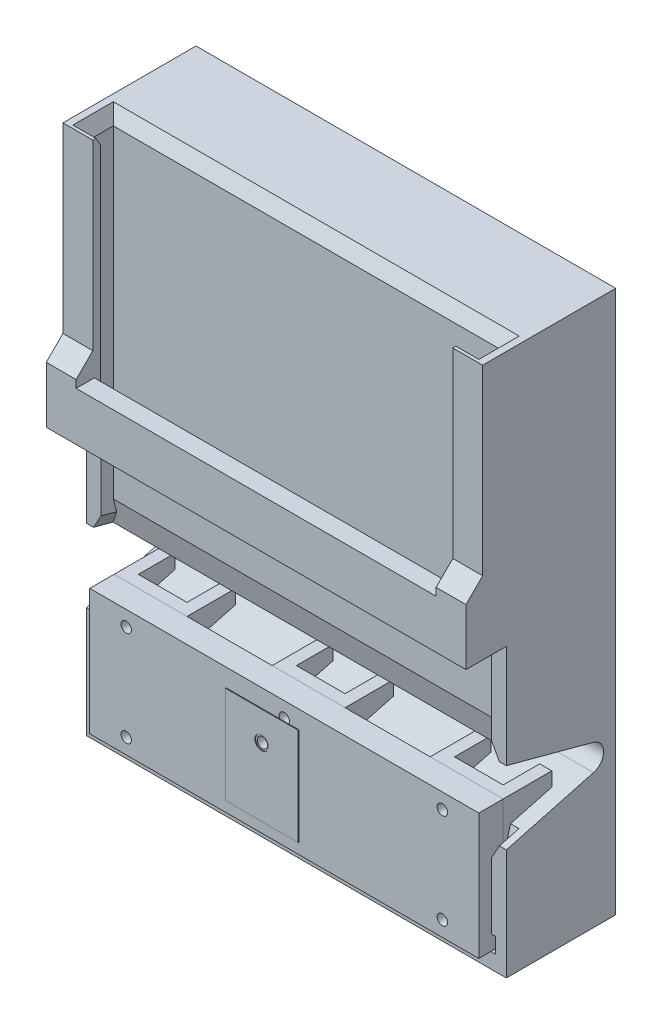
from build123d import *
from OCP.BRepFilletAPI import BRepFilletAPI_MakeChamfer

# Parameters (mm, degrees)
SKETCH1_W                          = 101.6
SKETCH1_H                          = 35.999999882
BOSS_EXTRUDE1_DEPTH                = 6.35
TAP_DRILL_FOR_6_32_TAP2_D          = 2.7051
SKETCH5_W                          = 16.399999966
SKETCH5_H                          = 3.000000096
CUT_EXTRUDE1_DEPTH                 = 61.104763545
MOVE_FACE1_BY                      = 0.100000054
MOVE_FACE1_2_BY                    = 0.100000054
MOVE_FACE1_3_BY                    = 0.100000054
MOVE_FACE1_4_BY                    = 0.100000054
SKETCH4_W                          = 19.05
SKETCH4_H                          = 25.4
SKETCH4_R                          = 1.78
BOSS_EXTRUDE2_DEPTH                = 0.178
BOSS_EXTRUDE3_DEPTH                = 32.899999732
LPATTERN1_COUNT                    = 3
LPATTERN1_PITCH                    = 41.275
SKETCH7_W                          = 101.6
SKETCH7_H                          = 3.10000015
CUT_EXTRUDE2_DEPTH                 = 63.730874382
SKETCH9_W                          = 1.35255
SKETCH9_H                          = 9.703
TAP_DRILL_FOR_6_32_TAP3_AT_2_COUNT = 2
TAP_DRILL_FOR_6_32_TAP3_AT_2_PITCH = 24.899999476
TAP_DRILL_FOR_6_32_TAP3_AT_3_COUNT = 2
TAP_DRILL_FOR_6_32_TAP3_AT_3_PITCH = 41.275
TAP_DRILL_FOR_6_32_TAP3_AT_4_COUNT = 2
TAP_DRILL_FOR_6_32_TAP3_AT_4_PITCH = 48.204103548
TAP_DRILL_FOR_6_32_TAP3_AT_5_COUNT = 2
TAP_DRILL_FOR_6_32_TAP3_AT_5_PITCH = 82.55
TAP_DRILL_FOR_6_32_TAP3_AT_6_COUNT = 2
TAP_DRILL_FOR_6_32_TAP3_AT_6_PITCH = 86.223619003
SKETCH15_W                         = 109.600000256
SKETCH15_H                         = 36.89999986
BOSS_EXTRUDE6_DEPTH                = 1.600000102
BOSS_EXTRUDE7_DEPTH                = 3.175
MOVE_FACE3_BY                      = 0.200000108
MOVE_FACE3_2_BY                    = 0.200000108
BOSS_EXTRUDE8_DEPTH                = 101.6
SKETCH18_W                         = 109.600000256
SKETCH18_H                         = 141.67499986
BOSS_EXTRUDE9_DEPTH                = 23.799999898
CUT_EXTRUDE5_DEPTH                 = 177.707301163
FILLET1_R                          = 3.543588
BOSS_EXTRUDE10_DEPTH               = 66.675
SKETCH21_W                         = 109.600000256
SKETCH21_H                         = 12.7
BOSS_EXTRUDE11_DEPTH               = 6.35
CHAMFER2_SIZE                      = 1.6
CHAMFER4_SIZE                      = 2
CHAMFER4_SIZE2                     = 3.464101615
CHAMFER4_SIZE2_2                   = 6.69213043
CHAMFER5_SIZE                      = 2
CHAMFER5_SIZE2                     = 3.464101615
CHAMFER6_SIZE                      = 1.2
CHAMFER6_SIZE2                     = 2.078460969
CHAMFER7_SIZE                      = 6.35
CUT_EXTRUDE6_DEPTH                 = 4.000000128


# Some blends are built 0.0001 mm under size
with BuildPart() as part:
    # Sketch1 → Boss-Extrude1 (new body)
    with BuildSketch(Plane.XY):
        with Locations((0, 13.490000071)):
            Rectangle(SKETCH1_W, SKETCH1_H)
    extrude(amount=BOSS_EXTRUDE1_DEPTH)

    # Tap Drill for #6-32 Tap2 (through all)
    with Locations(Plane.XY.offset(6.35)):
        with Locations((-5.70000003, 19.184999984)):
            Hole(TAP_DRILL_FOR_6_32_TAP2_D / 2)

    # Sketch5 → Cut-Extrude1 (cut, through all)
    with BuildSketch(Plane.XY.offset(6.35)):
        with Locations((42.600000017, -3.009999822)):
            Rectangle(SKETCH5_W, SKETCH5_H)
        with Locations((-42.600000017, -3.009999822)):
            Rectangle(SKETCH5_W, SKETCH5_H)
    extrude(amount=-CUT_EXTRUDE1_DEPTH, mode=Mode.SUBTRACT)

    # Move Face1: a face moved inward by 0.1
    extrude(part.faces().sort_by_distance((-42.600000017, -1.509999774, 3.175))[0], amount=MOVE_FACE1_BY, dir=(0, 1, 0), mode=Mode.SUBTRACT)

    # Move Face1 2: a face moved inward by 0.1
    extrude(part.faces().sort_by_distance((-34.400000034, -3.009999822, 3.175))[0], amount=MOVE_FACE1_2_BY, dir=(1, 0, 0), mode=Mode.SUBTRACT)

    # Move Face1 3: a face moved inward by 0.1
    extrude(part.faces().sort_by_distance((34.400000034, -3.009999822, 3.175))[0], amount=MOVE_FACE1_3_BY, dir=(-1, 0, 0), mode=Mode.SUBTRACT)

    # Move Face1 4: a face moved inward by 0.1
    extrude(part.faces().sort_by_distance((42.600000017, -1.509999774, 3.175))[0], amount=MOVE_FACE1_4_BY, dir=(0, 1, 0), mode=Mode.SUBTRACT)

    # Sketch7 → Cut-Extrude2 (cut, through all)
    with BuildSketch(Plane.XY.offset(6.35)):
        with Locations((0, -2.959999795)):
            Rectangle(SKETCH7_W, SKETCH7_H)
    extrude(amount=-CUT_EXTRUDE2_DEPTH, mode=Mode.SUBTRACT)


with BuildPart() as body_2:
    # Sketch4 → Boss-Extrude2 (new body)
    with BuildSketch(Plane.XY.offset(6.35)):
        with Locations((-5.70000003, 14.104999984)):
            Rectangle(SKETCH4_W, SKETCH4_H)
        with Locations(Location((-5.70000003, 19.184999984, 0), (0, 0, 180))):
            Circle(SKETCH4_R, mode=Mode.SUBTRACT)
    extrude(amount=BOSS_EXTRUDE2_DEPTH)


with BuildPart() as body_3:
    # Sketch6 → Boss-Extrude3 (new body)
    with BuildSketch(Plane(origin=(0, 31.490000012, 0), x_dir=(1, 0, 0), z_dir=(0, 1, 0))):
        Polygon((50.8, 12.7), (50.8, 0), (31.75, 0), (31.75, 12.7), (34.925, 12.7), (34.925, 3.175), (47.625, 3.175), (47.625, 12.7), align=None)
    extrude(amount=-BOSS_EXTRUDE3_DEPTH)


with BuildPart() as lpattern1_1:
    # LPattern1: pattern copy
    add(body_3.part.moved(Location(Vector(-1, 0, 0) * (1 * LPATTERN1_PITCH))))


with BuildPart() as lpattern1_2:
    # LPattern1: pattern copy
    add(body_3.part.moved(Location(Vector(-1, 0, 0) * (2 * LPATTERN1_PITCH))))


with BuildPart() as tap_drill_for_6_32_tap3_tool:
    # Sketch9 → Tap Drill for #6-32 Tap3 (revolve)
    with BuildSketch(Plane(origin=(41.275, 27.489999884, -3.175), x_dir=(0, 1, 0), z_dir=(1, 0, 0))):
        with Locations((0.676275, 4.8515)):
            Rectangle(SKETCH9_W, SKETCH9_H)
    tap_drill_for_6_32_tap3 = revolve(axis=Axis((41.275, 27.489999884, -9.525), (0, 0, 1)))


with BuildPart() as part_1:
    add(part.part)

    # Tap Drill for #6-32 Tap3: cut by tap_drill_for_6_32_tap3_tool
    add(tap_drill_for_6_32_tap3_tool.part, mode=Mode.SUBTRACT)


with BuildPart() as body_3_1:
    add(body_3.part)

    # Tap Drill for #6-32 Tap3: cut by tap_drill_for_6_32_tap3_tool
    add(tap_drill_for_6_32_tap3_tool.part, mode=Mode.SUBTRACT)


with BuildPart() as tap_drill_for_6_32_tap3_at_2_tool:
    # Tap Drill for #6-32 Tap3 at 2: Tap Drill for #6-32 Tap3 ×2
    with Locations(*[(0, -i * TAP_DRILL_FOR_6_32_TAP3_AT_2_PITCH, 0) for i in range(1, TAP_DRILL_FOR_6_32_TAP3_AT_2_COUNT)]):
        add(tap_drill_for_6_32_tap3)


with BuildPart() as part_2:
    add(part_1.part)

    # Tap Drill for #6-32 Tap3 at 2: cut by tap_drill_for_6_32_tap3_at_2_tool
    add(tap_drill_for_6_32_tap3_at_2_tool.part, mode=Mode.SUBTRACT)


with BuildPart() as body_3_2:
    add(body_3_1.part)

    # Tap Drill for #6-32 Tap3 at 2: cut by tap_drill_for_6_32_tap3_at_2_tool
    add(tap_drill_for_6_32_tap3_at_2_tool.part, mode=Mode.SUBTRACT)


with BuildPart() as tap_drill_for_6_32_tap3_at_3_tool:
    # Tap Drill for #6-32 Tap3 at 3: Tap Drill for #6-32 Tap3 ×2
    with Locations(*[(-i * TAP_DRILL_FOR_6_32_TAP3_AT_3_PITCH, 0, 0) for i in range(1, TAP_DRILL_FOR_6_32_TAP3_AT_3_COUNT)]):
        add(tap_drill_for_6_32_tap3)


with BuildPart() as part_3:
    add(part_2.part)

    # Tap Drill for #6-32 Tap3 at 3: cut by tap_drill_for_6_32_tap3_at_3_tool
    add(tap_drill_for_6_32_tap3_at_3_tool.part, mode=Mode.SUBTRACT)


with BuildPart() as lpattern1_1_1:
    add(lpattern1_1.part)

    # Tap Drill for #6-32 Tap3 at 3: cut by tap_drill_for_6_32_tap3_at_3_tool
    add(tap_drill_for_6_32_tap3_at_3_tool.part, mode=Mode.SUBTRACT)


with BuildPart() as tap_drill_for_6_32_tap3_at_4_tool:
    # Tap Drill for #6-32 Tap3 at 4: Tap Drill for #6-32 Tap3 ×2
    with Locations(*[Vector(-0.8562549028332803, -0.5165535222742845, 0) * (i * TAP_DRILL_FOR_6_32_TAP3_AT_4_PITCH) for i in range(1, TAP_DRILL_FOR_6_32_TAP3_AT_4_COUNT)]):
        add(tap_drill_for_6_32_tap3)


with BuildPart() as part_4:
    add(part_3.part)

    # Tap Drill for #6-32 Tap3 at 4: cut by tap_drill_for_6_32_tap3_at_4_tool
    add(tap_drill_for_6_32_tap3_at_4_tool.part, mode=Mode.SUBTRACT)


with BuildPart() as lpattern1_1_2:
    add(lpattern1_1_1.part)

    # Tap Drill for #6-32 Tap3 at 4: cut by tap_drill_for_6_32_tap3_at_4_tool
    add(tap_drill_for_6_32_tap3_at_4_tool.part, mode=Mode.SUBTRACT)


with BuildPart() as tap_drill_for_6_32_tap3_at_5_tool:
    # Tap Drill for #6-32 Tap3 at 5: Tap Drill for #6-32 Tap3 ×2
    with Locations(*[(-i * TAP_DRILL_FOR_6_32_TAP3_AT_5_PITCH, 0, 0) for i in range(1, TAP_DRILL_FOR_6_32_TAP3_AT_5_COUNT)]):
        add(tap_drill_for_6_32_tap3)


with BuildPart() as part_5:
    add(part_4.part)

    # Tap Drill for #6-32 Tap3 at 5: cut by tap_drill_for_6_32_tap3_at_5_tool
    add(tap_drill_for_6_32_tap3_at_5_tool.part, mode=Mode.SUBTRACT)


with BuildPart() as lpattern1_2_1:
    add(lpattern1_2.part)

    # Tap Drill for #6-32 Tap3 at 5: cut by tap_drill_for_6_32_tap3_at_5_tool
    add(tap_drill_for_6_32_tap3_at_5_tool.part, mode=Mode.SUBTRACT)


with BuildPart() as tap_drill_for_6_32_tap3_at_6_tool:
    # Tap Drill for #6-32 Tap3 at 6: Tap Drill for #6-32 Tap3 ×2
    with Locations(*[Vector(-0.9573942842449561, -0.28878397548182655, 0) * (i * TAP_DRILL_FOR_6_32_TAP3_AT_6_PITCH) for i in range(1, TAP_DRILL_FOR_6_32_TAP3_AT_6_COUNT)]):
        add(tap_drill_for_6_32_tap3)


with BuildPart() as part_6:
    add(part_5.part)

    # Tap Drill for #6-32 Tap3 at 6: cut by tap_drill_for_6_32_tap3_at_6_tool
    add(tap_drill_for_6_32_tap3_at_6_tool.part, mode=Mode.SUBTRACT)


with BuildPart() as lpattern1_2_2:
    add(lpattern1_2_1.part)

    # Tap Drill for #6-32 Tap3 at 6: cut by tap_drill_for_6_32_tap3_at_6_tool
    add(tap_drill_for_6_32_tap3_at_6_tool.part, mode=Mode.SUBTRACT)


with BuildPart() as body_6:
    # Sketch15 → Boss-Extrude6 (new body)
    with BuildSketch(Plane(origin=(0, 0, 0), x_dir=(-1, 0, 0), z_dir=(0, 0, -1))):
        with Locations((0, 13.040000082)):
            Rectangle(SKETCH15_W, SKETCH15_H)
    extrude(amount=BOSS_EXTRUDE6_DEPTH)

    # Sketch16 → Boss-Extrude7 (add)
    with BuildSketch(Plane.XY):
        Polygon((-50.8, 31.490000012), (-50.8, -1.40999972), (50.8, -1.40999972), (50.8, 31.490000012), (54.800000128, 31.490000012), (54.800000128, -5.409999848), (-54.800000128, -5.409999848), (-54.800000128, 31.490000012), align=None)
    extrude(amount=BOSS_EXTRUDE7_DEPTH)

    # Move Face3: a face moved inward by 0.2
    extrude(body_6.faces().sort_by_distance((50.8, 15.040000146, 1.5875))[0], amount=MOVE_FACE3_BY, dir=(1, 0, 0), mode=Mode.SUBTRACT)

    # Move Face3 2: a face moved inward by 0.2
    extrude(body_6.faces().sort_by_distance((-50.8, 15.040000146, 1.5875))[0], amount=MOVE_FACE3_2_BY, dir=(-1, 0, 0), mode=Mode.SUBTRACT)


with BuildPart() as body_7:
    # Sketch17 → Boss-Extrude8 (new body)
    with BuildSketch(Plane(origin=(0, 34.665000012, 0), x_dir=(1, 0, 0), z_dir=(0, 1, 0))):
        Polygon((54.800000128, -3.175), (54.800000128, 1.600000102), (-54.800000128, 1.600000102), (-54.800000128, -3.175), (-51.000000108, -3.175), (-51.000000108, 0), (51.000000108, 0), (51.000000108, -3.175), align=None)
    extrude(amount=BOSS_EXTRUDE8_DEPTH)


    add(body_6.part)  # Boss-Extrude9 merges body 6
    # Sketch18 → Boss-Extrude9 (add)
    with BuildSketch(Plane(origin=(0, 0, -1.600000102), x_dir=(-1, 0, 0), z_dir=(0, 0, -1))):
        with Locations((0, 65.427500082)):
            Rectangle(SKETCH18_W, SKETCH18_H)
    extrude(amount=BOSS_EXTRUDE9_DEPTH)

    # Sketch19 → Cut-Extrude5 (cut, through all)
    with BuildSketch(Plane(origin=(54.800000128, 0, 0), x_dir=(0, 0, -1), z_dir=(1, 0, 0))):
        Polygon((22.225, 35.796590524), (-3.175, 42.602500012), (-3.175, 23.552500012), (22.225, 30.3584095), align=None)
    extrude(amount=-CUT_EXTRUDE5_DEPTH, mode=Mode.SUBTRACT)

    # Fillet1
    fillet1_edges = [body_7.edges().sort_by_distance(p)[0] for p in [
        (0, 30.3584095, -22.225),
        (0, 35.796590524, -22.225),
    ]]
    fillet(fillet1_edges, radius=FILLET1_R - 0.0001)  # a hair under: the kernel refuses the full size

    # Sketch20 → Boss-Extrude10 (add)
    with BuildSketch(Plane(origin=(0, 69.590000012, 0), x_dir=(1, 0, 0), z_dir=(0, 1, 0))):
        Polygon((46.99999998, -9.350000096), (54.800000128, -9.350000096), (54.800000128, -3.175), (51.000000108, -3.175), (51.000000108, -7.350000032), (46.99999998, -7.350000032), align=None)
        Polygon((-54.800000128, -3.175), (-54.800000128, -9.350000096), (-46.99999998, -9.350000096), (-46.99999998, -7.350000032), (-51.000000108, -7.350000032), (-51.000000108, -3.175), align=None)
    extrude(amount=BOSS_EXTRUDE10_DEPTH)

    # Sketch21 → Boss-Extrude11 (add)
    with BuildSketch(Plane(origin=(0, 0, 7.350000032), x_dir=(-1, 0, 0), z_dir=(0, 0, -1))):
        with Locations((0, 75.940000012)):
            Rectangle(SKETCH21_W, SKETCH21_H)
    extrude(amount=-BOSS_EXTRUDE11_DEPTH)

    # Chamfer2
    chamfer2_edges = [body_7.edges().sort_by_distance(p)[0] for p in [
        (0, 82.290000012, 7.350000032),
    ]]
    chamfer(chamfer2_edges, length=CHAMFER2_SIZE)

    # Chamfer4: one chamfer whose edges measure the first distance from different faces: ONE call of the kernel's chamfer builder (chamfer() names one face for all edges)
    chamfer4_edges_1 = [body_7.edges().sort_by_distance(p)[0] for p in [
        (51.000000108, 42.177130669, 1.5875),
        (-51.000000108, 42.177130669, 1.5875),
    ]]
    chamfer4_side_1 = [body_7.faces().sort_by_distance(p)[0] for p in [
        (0, 39.159936336, -9.672822546),
    ]]
    chamfer4_edges_2 = [body_7.edges().sort_by_distance(p)[0] for p in [
        (0, 41.751761326, 0),
    ]]
    chamfer4_side_2 = [body_7.faces().sort_by_distance(p)[0] for p in [
        (0, 39.159936336, -9.672822546),
    ]]
    chamfer4_edges_3 = [body_7.edges().sort_by_distance(p)[0] for p in [
        (51.000000108, 23.977869355, 1.5875),
        (-51.000000108, 23.977869355, 1.5875),
    ]]
    chamfer4_side_3 = [body_7.faces().sort_by_distance(p)[0] for p in [
        (0, 26.995063688, -9.672822546),
    ]]
    chamfer4_edges_4 = [body_7.edges().sort_by_distance(p)[0] for p in [
        (0, 24.403238698, 0),
    ]]
    chamfer4_side_4 = [body_7.faces().sort_by_distance(p)[0] for p in [
        (0, 26.995063688, -9.672822546),
    ]]
    chamfer4 = BRepFilletAPI_MakeChamfer(body_7.part.solid().wrapped)
    for e in chamfer4_edges_1:
        chamfer4.Add(CHAMFER4_SIZE, CHAMFER4_SIZE2, e.wrapped, chamfer4_side_1[0].wrapped)  # the first distance lies on this face
    for e in chamfer4_edges_2:
        chamfer4.Add(CHAMFER4_SIZE, CHAMFER4_SIZE2_2, e.wrapped, chamfer4_side_2[0].wrapped)  # the first distance lies on this face
    for e in chamfer4_edges_3:
        chamfer4.Add(CHAMFER4_SIZE, CHAMFER4_SIZE2, e.wrapped, chamfer4_side_3[0].wrapped)  # the first distance lies on this face
    for e in chamfer4_edges_4:
        chamfer4.Add(CHAMFER4_SIZE, CHAMFER4_SIZE2_2, e.wrapped, chamfer4_side_4[0].wrapped)  # the first distance lies on this face
    add(Compound.cast(chamfer4.Shape()), mode=Mode.REPLACE)

    # Chamfer5
    chamfer5_edges = [body_7.edges().sort_by_distance(p)[0] for p in [
        (-51.000000108, 136.265000012, 3.675000016),
        (0, 136.265000012, 0),
        (51.000000108, 136.265000012, 3.675000016),
    ]]
    chamfer5_side = [body_7.faces().sort_by_distance(p)[0] for p in [
        (0, 136.265000012, -12.152621986),
    ]]
    chamfer(chamfer5_edges, length=CHAMFER5_SIZE, length2=CHAMFER5_SIZE2, reference=chamfer5_side[0])

    # Chamfer6
    chamfer6_edges = [body_7.edges().sort_by_distance(p)[0] for p in [
        (50.000000044, 136.265000012, 7.350000032),
        (-50.000000044, 136.265000012, 7.350000032),
    ]]
    chamfer6_side = [body_7.faces().sort_by_distance(p)[0] for p in [
        (0, 136.265000012, -13.228753549),
    ]]
    chamfer(chamfer6_edges, length=CHAMFER6_SIZE, length2=CHAMFER6_SIZE2, reference=chamfer6_side[0])

    # Chamfer7
    # the kernel refuses this chamfer: 6.35 mm, written as the material it adds along each edge
    with BuildSketch(Plane(origin=(-54.800000128, 82.290000012, 9.350000096), x_dir=(0, -0.027495876610585654, 0.9996219169112968), z_dir=(1, 0, 0))) as chamfer7_piece_1_section:
        Polygon((CHAMFER7_SIZE * 0.999621916911, -CHAMFER7_SIZE * 0.0274958766106), (-CHAMFER7_SIZE * 0.0274958766106, -CHAMFER7_SIZE * 0.999621916911), (0, 0), align=None)
    chamfer7_piece_1 = extrude(amount=7.800000148, mode=Mode.PRIVATE)
    chamfer7_piece_1 = split(chamfer7_piece_1, bisect_by=Plane(origin=(-50.900000054, 84.583638533, 13.700000032), z_dir=(0, 0, -1)), keep=Keep.TOP, mode=Mode.PRIVATE)
    add(chamfer7_piece_1)
    with BuildSketch(Plane(origin=(46.99999998, 82.290000012, 9.350000096), x_dir=(0, -0.027495876610585654, 0.9996219169112968), z_dir=(1, 0, 0))) as chamfer7_piece_2_section:
        Polygon((CHAMFER7_SIZE * 0.999621916911, -CHAMFER7_SIZE * 0.0274958766106), (-CHAMFER7_SIZE * 0.0274958766106, -CHAMFER7_SIZE * 0.999621916911), (0, 0), align=None)
    chamfer7_piece_2 = extrude(amount=7.800000148, mode=Mode.PRIVATE)
    chamfer7_piece_2 = split(chamfer7_piece_2, bisect_by=Plane(origin=(50.900000054, 84.583638533, 13.700000032), z_dir=(0, 0, -1)), keep=Keep.TOP, mode=Mode.PRIVATE)
    add(chamfer7_piece_2)

    # Sketch22 → Cut-Extrude6 (cut)
    with BuildSketch(Plane(origin=(0, -1.40999972, 0), x_dir=(1, 0, 0), z_dir=(0, 1, 0))):
        with BuildLine():
            Line((-52.00000014, -3.175), (52.00000014, -3.175))
            Line((52.00000014, -3.175), (52.00000014, 2.000000064))
            ThreePointArc((52.00000014, 2.000000064), (51.414213684, 3.414213672), (50.000000076, 4.000000128))
            Line((50.000000076, 4.000000128), (-50.000000076, 4.000000128))
            ThreePointArc((-50.000000076, 4.000000128), (-51.414213684, 3.414213672), (-52.00000014, 2.000000064))
            Line((-52.00000014, 2.000000064), (-52.00000014, -3.175))
        make_face()
    extrude(amount=CUT_EXTRUDE6_DEPTH, mode=Mode.SUBTRACT)


solid = Compound([body_2.part, body_3_2.part, lpattern1_1_2.part, part_6.part, lpattern1_2_2.part, body_7.part])
